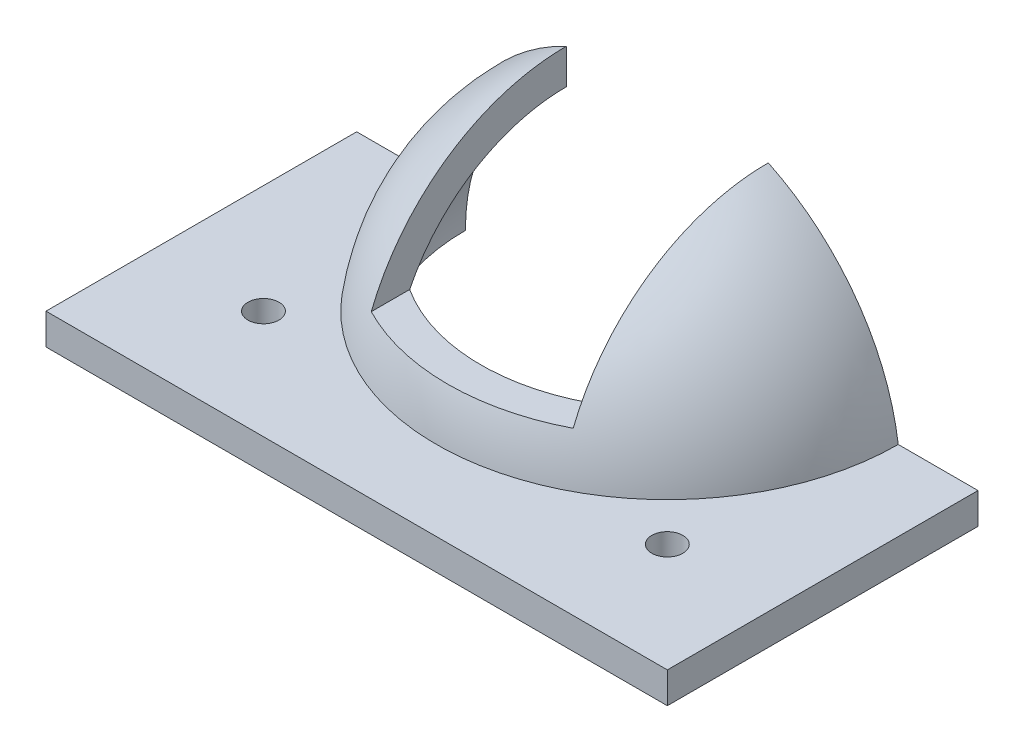
from build123d import *

# Parameters (mm, degrees)
SKETCH2_W            = 16.51
SKETCH2_H            = 16.418842622
CUT_EXTRUDE1_DEPTH   = 63.5
SKETCH3_W            = 50.8
SKETCH3_H            = 50.8
SKETCH3_R            = 16.51
BOSS_EXTRUDE1_DEPTH  = 2.54
SKETCH5_R            = 1.27
CUT_EXTRUDE3_DEPTH   = 39.785475152
LPATTERN1_COUNT      = 2
LPATTERN1_PITCH      = 33.02
LPATTERN1_COUNT_DIR2 = 2
LPATTERN1_PITCH_DIR2 = 33.02
SKETCH6_W            = 56.281524163
SKETCH6_H            = 20.147031274
CUT_EXTRUDE4_DEPTH   = 40.813031472


with BuildPart() as part:
    # Sketch1 → Revolve1 (revolve)
    with BuildSketch(Plane.XY):
        with BuildLine():
            Line((19.05, 0), (16.51, 0))
            ThreePointArc((16.51, 0), (11.674332957, 11.674332957), (0, 16.51))
            Line((0, 16.51), (0, 19.05))
            ThreePointArc((0, 19.05), (13.470384182, 13.470384182), (19.05, 0))
        make_face()
    revolve(axis=Axis((0, 19.05, 0), (0, -1, 0)))

    # Sketch2 → Cut-Extrude1 (cut, symmetric)
    with BuildSketch(Plane.XY):
        with Locations((0, 14.559421311)):
            Rectangle(SKETCH2_W, SKETCH2_H)
    extrude(amount=CUT_EXTRUDE1_DEPTH, both=True, mode=Mode.SUBTRACT)

    # Sketch3 → Boss-Extrude1 (add)
    with BuildSketch(Plane.XZ):
        Rectangle(SKETCH3_W, SKETCH3_H)
        Circle(SKETCH3_R, mode=Mode.SUBTRACT)
    extrude(amount=-BOSS_EXTRUDE1_DEPTH)

    # Sketch5 → Cut-Extrude3 (cut, through all)
    with BuildSketch(Plane(origin=(0, 2.54, 0), x_dir=(1, 0, 0), z_dir=(0, 1, 0))):
        with Locations((-16.51, 16.51)):
            Circle(SKETCH5_R)
    cut_extrude3 = extrude(amount=-CUT_EXTRUDE3_DEPTH, mode=Mode.SUBTRACT)

    # LPattern1: Cut-Extrude3 2 × 2
    with Locations(*[(i * LPATTERN1_PITCH, 0, j * LPATTERN1_PITCH_DIR2) for i in range(LPATTERN1_COUNT) for j in range(LPATTERN1_COUNT_DIR2) if (i, j) != (0, 0)]):
        add(cut_extrude3, mode=Mode.SUBTRACT)

    # Sketch6 → Cut-Extrude4 (cut, through all)
    with BuildSketch(Plane.XY):
        with Locations((0.297112119, 7.848545007)):
            Rectangle(SKETCH6_W, SKETCH6_H)
    extrude(amount=-CUT_EXTRUDE4_DEPTH, mode=Mode.SUBTRACT)


solid = part.part
